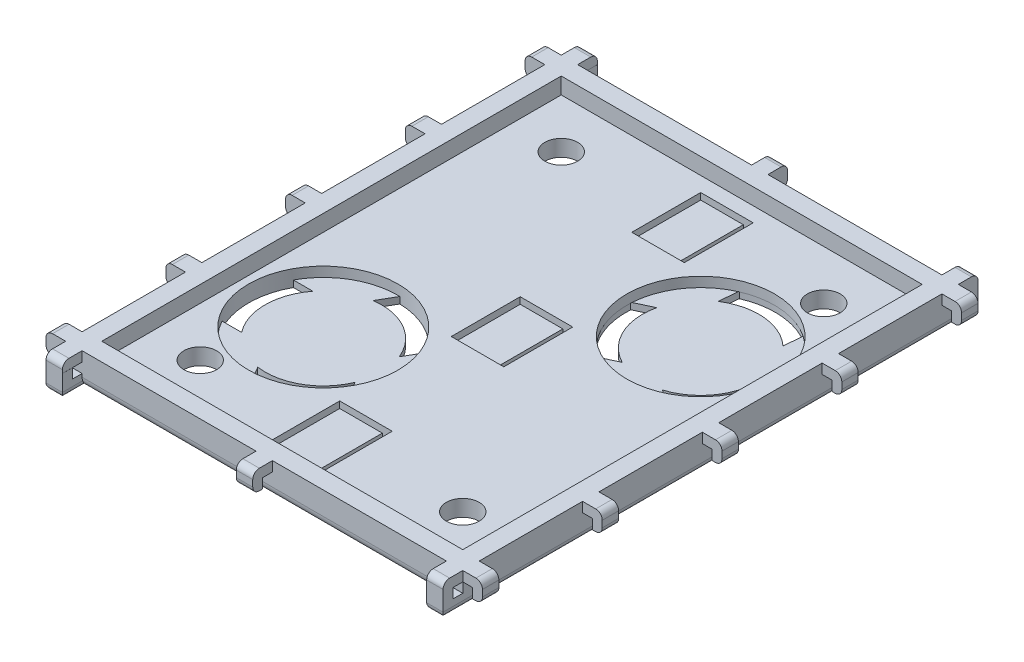
from build123d import *

# Parameters (mm, degrees)
SKETCH2_W               = 121
SKETCH2_H               = 151
BOSS_EXTRUDE1_DEPTH     = 10
SKETCH3_W               = 110
SKETCH3_H               = 140
CUT_EXTRUDE1_DEPTH      = 5
SKETCH4_R               = 5
CUT_EXTRUDE2_DEPTH      = 97.878790248
MIRROR2_COPY_1_SKETCH_R = 5
MIRROR2_COPY_1_DEPTH    = 97.878790248
SKETCH6_W               = 16
SKETCH6_H               = 21
CUT_EXTRUDE3_DEPTH      = 2
SKETCH9_W               = 3.011368741
SKETCH9_H               = 21
CUT_EXTRUDE4_DEPTH      = 98.002577285
SKETCH10_R              = 22.75
SKETCH10_R_2            = 22.5
CUT_EXTRUDE5_DEPTH      = 3
SKETCH12_W              = 5
SKETCH12_H              = 6
BOSS_EXTRUDE3_DEPTH     = 6
CUT_EXTRUDE6_REACH      = 148.23
SKETCH14_W              = 3
SKETCH14_H              = 3
FILLET1_R               = 2
LPATTERN3_COUNT         = 3
LPATTERN3_PITCH         = 58
FILLET1_OF_LPATTERN3_R  = 2
MIRROR3_START           = -60.5
MIRROR3_DEPTH           = 5
MIRROR3_START_2         = -2.5
MIRROR3_2_DEPTH         = 5
MIRROR3_START_3         = 55.5
MIRROR3_3_DEPTH         = 5
SKETCH15_W              = 5
SKETCH15_H              = 6
BOSS_EXTRUDE4_DEPTH     = 6
CUT_EXTRUDE7_REACH      = 168.211
SKETCH16_W              = 3
SKETCH16_H              = 3
FILLET2_R               = 2
LPATTERN4_COUNT         = 5
LPATTERN4_PITCH         = 36.5
FILLET2_OF_LPATTERN4_R  = 2
MIRROR4_START           = -75.5
MIRROR4_DEPTH           = 5
MIRROR4_START_2         = -39
MIRROR4_2_DEPTH         = 5
MIRROR4_START_3         = -2.5
MIRROR4_3_DEPTH         = 5
MIRROR4_START_4         = 34
MIRROR4_4_DEPTH         = 5
MIRROR4_START_5         = 70.5
MIRROR4_5_DEPTH         = 5
LPATTERN5_COUNT         = 3
LPATTERN5_PITCH         = 55
FILLET3_R               = 3
BOSS_EXTRUDE5_START     = -157
SKETCH17_W              = 5.009304853
SKETCH17_H              = 4
BOSS_EXTRUDE5_DEPTH     = 163
SKETCH18_W              = 5.009304853
SKETCH18_H              = 3
BOSS_EXTRUDE6_DEPTH     = 3
SKETCH19_W              = 5.009304853
SKETCH19_H              = 3
BOSS_EXTRUDE7_DEPTH     = 3
FILLET4_R               = 2
FILLET5_R               = 2
CUT_EXTRUDE8_DEPTH      = 106.491705912
CIRPATTERN1_COUNT       = 3
MIRROR7_COPY_1_DEPTH    = 106.491705912
MIRROR7_COPY_2_DEPTH    = 106.491705912


# Read off the part's stored shape, not the designer's step: Mirror3, Mirror4
with BuildPart() as part:
    # Sketch2 → Boss-Extrude1 (new body)
    with BuildSketch(Plane(origin=(0, 0, 0), x_dir=(1, 0, 0), z_dir=(0, 1, 0))):
        Rectangle(SKETCH2_W, SKETCH2_H)
    extrude(amount=BOSS_EXTRUDE1_DEPTH)

    # Sketch3 → Cut-Extrude1 (cut)
    with BuildSketch(Plane(origin=(0, 10, 0), x_dir=(1, 0, 0), z_dir=(0, 1, 0))):
        Rectangle(SKETCH3_W, SKETCH3_H)
    extrude(amount=-CUT_EXTRUDE1_DEPTH, mode=Mode.SUBTRACT)

    # Sketch4 → Cut-Extrude2 (cut, through all)
    with BuildSketch(Plane(origin=(0, 5, 0), x_dir=(1, 0, 0), z_dir=(0, 1, 0))):
        with Locations(Location((-40, 55, 0), (0, 0, 270))):
            Circle(SKETCH4_R)
    cut_extrude2 = extrude(amount=-CUT_EXTRUDE2_DEPTH, mode=Mode.SUBTRACT)

    # Mirror1: Cut-Extrude2 across plane
    add(cut_extrude2.mirror(Plane(origin=(0, 0, 0), x_dir=(0, 0, 1), z_dir=(1, 0, 0))), mode=Mode.SUBTRACT)

    # Mirror2: Cut-Extrude2 across plane
    add(cut_extrude2.mirror(Plane.XY), mode=Mode.SUBTRACT)

    # Mirror2 copy 1 sketch → Mirror2 copy 1 (cut, through all)
    with BuildSketch(Plane(origin=(0, 5, 0), x_dir=(-1, 0, 0), z_dir=(0, 1, 0))):
        with Locations(Location((-40, 55, 0), (0, 0, 270))):
            Circle(MIRROR2_COPY_1_SKETCH_R)
    extrude(amount=-MIRROR2_COPY_1_DEPTH, mode=Mode.SUBTRACT)

    # Sketch6 → Cut-Extrude3 (cut)
    with BuildSketch(Plane(origin=(0, 5, 0), x_dir=(1, 0, 0), z_dir=(0, 1, 0))):
        with Locations((0, 55)):
            Rectangle(SKETCH6_W, SKETCH6_H)
        Rectangle(SKETCH6_W, SKETCH6_H)
        with Locations((0, -55)):
            Rectangle(SKETCH6_W, SKETCH6_H)
    extrude(amount=-CUT_EXTRUDE3_DEPTH, mode=Mode.SUBTRACT)

    # Sketch9 → Cut-Extrude4 (cut, through all)
    with BuildSketch(Plane(origin=(0, 3, 0), x_dir=(1, 0, 0), z_dir=(0, 1, 0))):
        with Locations((6.494315629, 55)):
            Rectangle(SKETCH9_W, SKETCH9_H)
    cut_extrude4 = extrude(amount=-CUT_EXTRUDE4_DEPTH, mode=Mode.SUBTRACT)

    # Sketch10 → Cut-Extrude5 (cut)
    with BuildSketch(Plane(origin=(0, 5, 0), x_dir=(1, 0, 0), z_dir=(0, 1, 0))):
        with Locations(Location((-30, -27.5, 0), (0, 0, 270))):
            Circle(SKETCH10_R)
        with Locations(Location((30, 27.5, 0), (0, 0, 270))):
            Circle(SKETCH10_R_2)
    extrude(amount=-CUT_EXTRUDE5_DEPTH, mode=Mode.SUBTRACT)

    # Sketch12 → Boss-Extrude3 (add)
    with BuildSketch(Plane.XY.offset(75.5)):
        with Locations((-58, 7)):
            Rectangle(SKETCH12_W, SKETCH12_H)
    boss_extrude3 = extrude(amount=BOSS_EXTRUDE3_DEPTH)

    # Sketch14 → Cut-Extrude6 (cut, up to next)
    with BuildSketch(Plane.ZY.offset(60.5), mode=Mode.PRIVATE) as cut_extrude6_sk1:
        with Locations((77, 5.5)):
            Rectangle(SKETCH14_W, SKETCH14_H)
    cut_extrude6_tool1 = extrude(cut_extrude6_sk1.sketch, amount=-CUT_EXTRUDE6_REACH, mode=Mode.PRIVATE) & part.part
    cut_extrude6 = cut_extrude6_tool1.solids().sort_by_distance((-60.5, 5.5, 77))[0]
    add(cut_extrude6, mode=Mode.SUBTRACT)

    # Fillet1
    fillet1_edges = [part.edges().sort_by_distance(p)[0] for p in [
        (-58, 4, 81.5),
        (-58, 10, 81.5),
    ]]
    fillet(fillet1_edges, radius=FILLET1_R)

    # LPattern3: Boss-Extrude3, Cut-Extrude6 ×3
    with Locations(*[(i * LPATTERN3_PITCH, 0, 0) for i in range(1, LPATTERN3_COUNT)]):
        add(boss_extrude3)
        add(cut_extrude6, mode=Mode.SUBTRACT)

    # Fillet1 of LPattern3
    fillet1_of_lpattern3_edges = [part.edges().sort_by_distance(p)[0] for p in [
        (0, 4, 81.5),
        (0, 10, 81.5),
        (58, 4, 81.5),
        (58, 10, 81.5),
    ]]
    fillet(fillet1_of_lpattern3_edges, radius=FILLET1_OF_LPATTERN3_R)

    # Mirror3 outline → Mirror3 (add)
    with BuildSketch(Plane.YZ.offset(MIRROR3_START)):
        with BuildLine():
            Line((7, -78.5), (4, -78.5))
            Line((4, -78.5), (4, -79.5))
            ThreePointArc((4, -79.5), (4.585786438, -80.914213562), (6, -81.5))
            Line((6, -81.5), (8, -81.5))
            ThreePointArc((8, -81.5), (9.414213562, -80.914213562), (10, -79.5))
            Line((10, -79.5), (10, -75.5))
            Line((10, -75.5), (7, -75.5))
            Line((7, -75.5), (7, -78.5))
        make_face()
    extrude(amount=MIRROR3_DEPTH)

    # Mirror3 2 outline → Mirror3 2 (add)
    with BuildSketch(Plane.YZ.offset(MIRROR3_START_2)):
        with BuildLine():
            Line((7, -78.5), (4, -78.5))
            Line((4, -78.5), (4, -79.5))
            ThreePointArc((4, -79.5), (4.585786438, -80.914213562), (6, -81.5))
            Line((6, -81.5), (8, -81.5))
            ThreePointArc((8, -81.5), (9.414213562, -80.914213562), (10, -79.5))
            Line((10, -79.5), (10, -75.5))
            Line((10, -75.5), (7, -75.5))
            Line((7, -75.5), (7, -78.5))
        make_face()
    extrude(amount=MIRROR3_2_DEPTH)

    # Mirror3 3 outline → Mirror3 3 (add)
    with BuildSketch(Plane.YZ.offset(MIRROR3_START_3)):
        with BuildLine():
            Line((7, -78.5), (4, -78.5))
            Line((4, -78.5), (4, -79.5))
            ThreePointArc((4, -79.5), (4.585786438, -80.914213562), (6, -81.5))
            Line((6, -81.5), (8, -81.5))
            ThreePointArc((8, -81.5), (9.414213562, -80.914213562), (10, -79.5))
            Line((10, -79.5), (10, -75.5))
            Line((10, -75.5), (7, -75.5))
            Line((7, -75.5), (7, -78.5))
        make_face()
    extrude(amount=MIRROR3_3_DEPTH)

    # Sketch15 → Boss-Extrude4 (add)
    with BuildSketch(Plane.ZY.offset(60.5)):
        with Locations((73, 7)):
            Rectangle(SKETCH15_W, SKETCH15_H)
    boss_extrude4 = extrude(amount=BOSS_EXTRUDE4_DEPTH)

    # Sketch16 → Cut-Extrude7 (cut, up to next)
    with BuildSketch(Plane(origin=(0, 0, 70.5), x_dir=(-1, 0, 0), z_dir=(0, 0, -1)), mode=Mode.PRIVATE) as cut_extrude7_sk1:
        with Locations((62, 5.5)):
            Rectangle(SKETCH16_W, SKETCH16_H)
    cut_extrude7_tool1 = extrude(cut_extrude7_sk1.sketch, amount=-CUT_EXTRUDE7_REACH, mode=Mode.PRIVATE) & part.part
    cut_extrude7 = cut_extrude7_tool1.solids().sort_by_distance((-62, 5.5, 70.5))[0]
    add(cut_extrude7, mode=Mode.SUBTRACT)

    # Fillet2
    fillet2_edges = [part.edges().sort_by_distance(p)[0] for p in [
        (-66.5, 10, 73),
        (-66.5, 4, 73),
    ]]
    fillet(fillet2_edges, radius=FILLET2_R)

    # LPattern4: Boss-Extrude4, Cut-Extrude7 ×5
    with Locations(*[(0, 0, -i * LPATTERN4_PITCH) for i in range(1, LPATTERN4_COUNT)]):
        add(boss_extrude4)
        add(cut_extrude7, mode=Mode.SUBTRACT)

    # Fillet2 of LPattern4
    fillet2_of_lpattern4_edges = [part.edges().sort_by_distance(p)[0] for p in [
        (-66.5, 10, 36.5),
        (-66.5, 4, 36.5),
        (-66.5, 10, 0),
        (-66.5, 4, 0),
        (-66.5, 10, -36.5),
        (-66.5, 4, -36.5),
        (-66.5, 10, -73),
        (-66.5, 4, -73),
    ]]
    fillet(fillet2_of_lpattern4_edges, radius=FILLET2_OF_LPATTERN4_R)

    # Mirror4 outline → Mirror4 (add)
    with BuildSketch(Plane.XY.offset(MIRROR4_START)):
        with BuildLine():
            Line((63.5, 7), (63.5, 4))
            Line((63.5, 4), (64.5, 4))
            ThreePointArc((64.5, 4), (65.914213562, 4.585786438), (66.5, 6))
            Line((66.5, 6), (66.5, 8))
            ThreePointArc((66.5, 8), (65.914213562, 9.414213562), (64.5, 10))
            Line((64.5, 10), (60.5, 10))
            Line((60.5, 10), (60.5, 7))
            Line((60.5, 7), (63.5, 7))
        make_face()
    extrude(amount=MIRROR4_DEPTH)

    # Mirror4 2 outline → Mirror4 2 (add)
    with BuildSketch(Plane.XY.offset(MIRROR4_START_2)):
        with BuildLine():
            Line((63.5, 7), (63.5, 4))
            Line((63.5, 4), (64.5, 4))
            ThreePointArc((64.5, 4), (65.914213562, 4.585786438), (66.5, 6))
            Line((66.5, 6), (66.5, 8))
            ThreePointArc((66.5, 8), (65.914213562, 9.414213562), (64.5, 10))
            Line((64.5, 10), (60.5, 10))
            Line((60.5, 10), (60.5, 7))
            Line((60.5, 7), (63.5, 7))
        make_face()
    extrude(amount=MIRROR4_2_DEPTH)

    # Mirror4 3 outline → Mirror4 3 (add)
    with BuildSketch(Plane.XY.offset(MIRROR4_START_3)):
        with BuildLine():
            Line((63.5, 7), (63.5, 4))
            Line((63.5, 4), (64.5, 4))
            ThreePointArc((64.5, 4), (65.914213562, 4.585786438), (66.5, 6))
            Line((66.5, 6), (66.5, 8))
            ThreePointArc((66.5, 8), (65.914213562, 9.414213562), (64.5, 10))
            Line((64.5, 10), (60.5, 10))
            Line((60.5, 10), (60.5, 7))
            Line((60.5, 7), (63.5, 7))
        make_face()
    extrude(amount=MIRROR4_3_DEPTH)

    # Mirror4 4 outline → Mirror4 4 (add)
    with BuildSketch(Plane.XY.offset(MIRROR4_START_4)):
        with BuildLine():
            Line((63.5, 7), (63.5, 4))
            Line((63.5, 4), (64.5, 4))
            ThreePointArc((64.5, 4), (65.914213562, 4.585786438), (66.5, 6))
            Line((66.5, 6), (66.5, 8))
            ThreePointArc((66.5, 8), (65.914213562, 9.414213562), (64.5, 10))
            Line((64.5, 10), (60.5, 10))
            Line((60.5, 10), (60.5, 7))
            Line((60.5, 7), (63.5, 7))
        make_face()
    extrude(amount=MIRROR4_4_DEPTH)

    # Mirror4 5 outline → Mirror4 5 (add)
    with BuildSketch(Plane.XY.offset(MIRROR4_START_5)):
        with BuildLine():
            Line((63.5, 7), (63.5, 4))
            Line((63.5, 4), (64.5, 4))
            ThreePointArc((64.5, 4), (65.914213562, 4.585786438), (66.5, 6))
            Line((66.5, 6), (66.5, 8))
            ThreePointArc((66.5, 8), (65.914213562, 9.414213562), (64.5, 10))
            Line((64.5, 10), (60.5, 10))
            Line((60.5, 10), (60.5, 7))
            Line((60.5, 7), (63.5, 7))
        make_face()
    extrude(amount=MIRROR4_5_DEPTH)

    # LPattern5: Cut-Extrude4 ×3
    with Locations(*[(0, 0, i * LPATTERN5_PITCH) for i in range(1, LPATTERN5_COUNT)]):
        add(cut_extrude4, mode=Mode.SUBTRACT)

    # Fillet3
    fillet3_edges = [part.edges().sort_by_distance(p)[0] for p in [
        (0, 0, 75.5),
        (-60.5, 0, 0),
        (0, 0, -75.5),
        (60.5, 0, 0),
    ]]
    fillet(fillet3_edges, radius=FILLET3_R)

    # Sketch17 → Boss-Extrude5 (add)
    with BuildSketch(Plane.XY.offset(75.5).offset(BOSS_EXTRUDE5_START)):
        with Locations((-57.995347574, 2)):
            Rectangle(SKETCH17_W, SKETCH17_H)
    boss_extrude5 = extrude(amount=BOSS_EXTRUDE5_DEPTH)

    # Sketch18 → Boss-Extrude6 (add)
    with BuildSketch(Plane(origin=(0, 4, 0), x_dir=(1, 0, 0), z_dir=(0, 1, 0))):
        with Locations((-57.995347574, -80)):
            Rectangle(SKETCH18_W, SKETCH18_H)
    boss_extrude6 = extrude(amount=BOSS_EXTRUDE6_DEPTH)

    # Sketch19 → Boss-Extrude7 (add)
    with BuildSketch(Plane(origin=(0, 4, 0), x_dir=(1, 0, 0), z_dir=(0, 1, 0))):
        with Locations((-57.995347574, 80)):
            Rectangle(SKETCH19_W, SKETCH19_H)
    boss_extrude7 = extrude(amount=BOSS_EXTRUDE7_DEPTH)

    # Fillet4
    fillet4_edges = [part.edges().sort_by_distance(p)[0] for p in [
        (-60.5, 0, 0),
        (-55.490695147, 0, 77),
        (-57.995347573, 0, -81.5),
        (-55.490695147, 0, -77),
        (-57.995347573, 0, 81.5),
    ]]
    fillet(fillet4_edges, radius=FILLET4_R)

    # Mirror6: Boss-Extrude5, Boss-Extrude6, Boss-Extrude7 across plane
    add(boss_extrude5.mirror(Plane(origin=(0, 0, 0), x_dir=(0, 0, 1), z_dir=(1, 0, 0))))
    add(boss_extrude6.mirror(Plane(origin=(0, 0, 0), x_dir=(0, 0, 1), z_dir=(1, 0, 0))))
    add(boss_extrude7.mirror(Plane(origin=(0, 0, 0), x_dir=(0, 0, 1), z_dir=(1, 0, 0))))

    # Fillet5
    fillet5_edges = [part.edges().sort_by_distance(p)[0] for p in [
        (60.5, 0, 0),
        (57.995347573, 0, 81.5),
        (55.490695147, 0, 77),
        (55.490695147, 0, -77),
        (57.995347573, 0, -81.5),
    ]]
    fillet(fillet5_edges, radius=FILLET5_R)

    # Sketch20 → Cut-Extrude8 (cut, through all)
    with BuildSketch(Plane(origin=(0, 2, 0), x_dir=(1, 0, 0), z_dir=(0, 1, 0))):
        with BuildLine():
            Line((-49.989367559, -38.362213613), (-44.038333784, -38.362213613))
            ThreePointArc((-44.038333784, -38.362213613), (-47.75, -27.5), (-44.038333784, -16.637786387))
            Line((-44.038333784, -16.637786387), (-49.989367559, -16.637786387))
            ThreePointArc((-49.989367559, -16.637786387), (-52.75, -27.5), (-49.989367559, -38.362213613))
        make_face()
    cut_extrude8 = extrude(amount=-CUT_EXTRUDE8_DEPTH, mode=Mode.SUBTRACT)

    # CirPattern1: Cut-Extrude8 ×3 about axis
    cirpattern1_axis = Axis((-30, 0, 27.5), (0, 1, 0))
    for i in range(1, CIRPATTERN1_COUNT):
        add(cut_extrude8.rotate(cirpattern1_axis, i * 360 / CIRPATTERN1_COUNT), mode=Mode.SUBTRACT)

    # Mirror7: Cut-Extrude8 across plane
    add(cut_extrude8.mirror(Plane(origin=(0, 0, 0), x_dir=(0.6757246285173467, 0, 0.7371541402007412), z_dir=(-0.7371541402007413, 0, 0.6757246285173466))), mode=Mode.SUBTRACT)

    # Mirror7 copy 1 sketch → Mirror7 copy 1 (cut, through all)
    with BuildSketch(Plane(origin=(21.184301396, 2, -67.230762114), x_dir=(-0.8193611569777054, 0, -0.573277676554875), z_dir=(0, 1, 0))):
        with BuildLine():
            Line((-49.989367559, 38.362213613), (-44.038333784, 38.362213613))
            ThreePointArc((-44.038333784, 38.362213613), (-47.75, 27.5), (-44.038333784, 16.637786387))
            Line((-44.038333784, 16.637786387), (-49.989367559, 16.637786387))
            ThreePointArc((-49.989367559, 16.637786387), (-52.75, 27.5), (-49.989367559, 38.362213613))
        make_face()
    extrude(amount=-MIRROR7_COPY_1_DEPTH, mode=Mode.SUBTRACT)

    # Mirror7 copy 2 sketch → Mirror7 copy 2 (cut, through all)
    with BuildSketch(Plane(origin=(68.815698604, 2, -15.269237886), x_dir=(0.9061536098078935, 0, -0.42294873853946513), z_dir=(0, 1, 0))):
        with BuildLine():
            Line((-49.989367559, 38.362213613), (-44.038333784, 38.362213613))
            ThreePointArc((-44.038333784, 38.362213613), (-47.75, 27.5), (-44.038333784, 16.637786387))
            Line((-44.038333784, 16.637786387), (-49.989367559, 16.637786387))
            ThreePointArc((-49.989367559, 16.637786387), (-52.75, 27.5), (-49.989367559, 38.362213613))
        make_face()
    extrude(amount=-MIRROR7_COPY_2_DEPTH, mode=Mode.SUBTRACT)


solid = part.part
